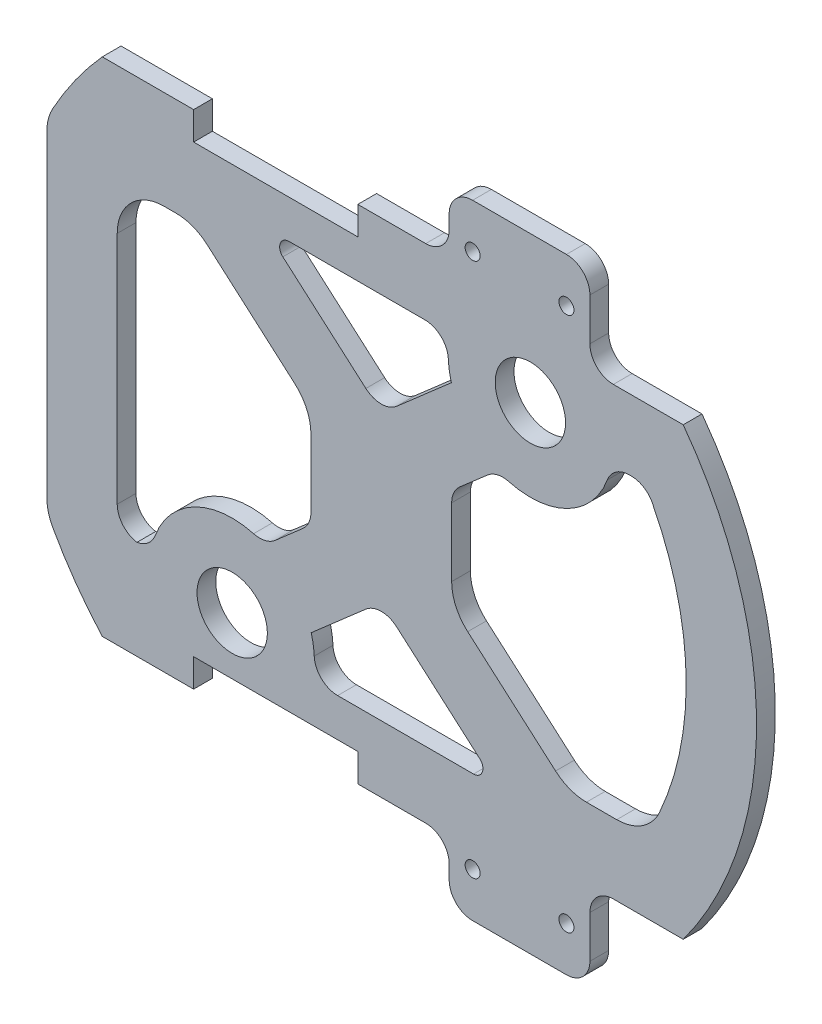
from build123d import *

# Parameters (mm, degrees)
ESBO_O1_R                = 7.5
ESBO_O1_R_2              = 1.6
RESSALTO_EXTRUS_O1_DEPTH = 4
FILETE2_R                = 10
FILETE3_R                = 5
FILETE4_R                = 2


with BuildPart() as part:
    # Esboço1 → Ressalto-extrusão1 (new body)
    with BuildSketch(Plane.XY):
        with BuildLine():
            Line((14.471901241, -53.5), (14.471901241, -66.5))
            Line((14.471901241, -66.5), (44.471901241, -66.5))
            Line((44.471901241, -66.5), (44.471901241, -47.5))
            Line((44.471901241, -47.5), (64.371965948, -47.5))
            ThreePointArc((64.371965948, -47.5), (80, 0), (64.371965948, 47.5))
            Line((64.371965948, 47.5), (44.471901241, 47.5))
            Line((44.471901241, 47.5), (44.471901241, 66.5))
            Line((44.471901241, 66.5), (14.471901241, 66.5))
            Line((14.471901241, 66.5), (14.471901241, 53.5))
            Line((14.471901241, 53.5), (-5.003543323, 53.5))
            Line((-5.003543323, 53.5), (-5.003543323, 47.5))
            Line((-5.003543323, 47.5), (-40.003543323, 47.5))
            Line((-40.003543323, 47.5), (-40.003543323, 53.5))
            Line((-40.003543323, 53.5), (-59.478987886, 53.5))
            ThreePointArc((-59.478987886, 53.5), (-65.948635083, 45.285511266), (-71.291651246, 36.297389198))
            Line((-71.291651246, 36.297389198), (-71.291651246, -36.297389198))
            ThreePointArc((-71.291651246, -36.297389198), (-65.948635083, -45.285511266), (-59.478987886, -53.5))
            Line((-59.478987886, -53.5), (-40.003543323, -53.5))
            Line((-40.003543323, -53.5), (-40.003543323, -47.5))
            Line((-40.003543323, -47.5), (-5.003543323, -47.5))
            Line((-5.003543323, -47.5), (-5.003543323, -53.5))
            Line((-5.003543323, -53.5), (14.471901241, -53.5))
        make_face()
        with Locations((-31.783703802, -35.29937921)):
            Circle(ESBO_O1_R, mode=Mode.SUBTRACT)
        with Locations((19.471901241, -57)):
            Circle(ESBO_O1_R_2, mode=Mode.SUBTRACT)
        with Locations((39.471901241, -57)):
            Circle(ESBO_O1_R_2, mode=Mode.SUBTRACT)
        with BuildLine():
            Line((25, -39.332538239), (-14.754798134, -39.332538239))
            ThreePointArc((-14.754798134, -39.332538239), (-14.287636143, -34.928412284), (-14.941054623, -30.548045856))
            Line((-14.941054623, -30.548045856), (0, -17.5))
            Line((0, -17.5), (25, -39.332538239))
        make_face(mode=Mode.SUBTRACT)
        with BuildLine():
            Line((-15, -10.684767074), (-24.807750727, -19.249890785))
            ThreePointArc((-24.807750727, -19.249890785), (-40.174599446, -19.942202702), (-49.058352164, -32.5))
            Line((-49.058352164, -32.5), (-56.291651246, -32.5))
            Line((-56.291651246, -32.5), (-56.291651246, 32.5))
            Line((-56.291651246, 32.5), (-39.980184035, 32.5))
            Line((-39.980184035, 32.5), (-15, 10.684767074))
            Line((-15, 10.684767074), (-15, -10.684767074))
        make_face(mode=Mode.SUBTRACT)
        with BuildLine():
            Line((49.058352164, 32.5), (56.291651246, 32.5))
            ThreePointArc((56.291651246, 32.5), (65, 0), (56.291651246, -32.5))
            Line((56.291651246, -32.5), (39.980184035, -32.5))
            Line((39.980184035, -32.5), (15, -10.684767074))
            Line((15, -10.684767074), (15, 10.684767074))
            Line((15, 10.684767074), (24.807750727, 19.249890785))
            ThreePointArc((24.807750727, 19.249890785), (40.174599446, 19.942202702), (49.058352164, 32.5))
        make_face(mode=Mode.SUBTRACT)
        with BuildLine():
            Line((0, 17.5), (-25, 39.332538239))
            Line((-25, 39.332538239), (14.754798134, 39.332538239))
            ThreePointArc((14.754798134, 39.332538239), (14.287636143, 34.928412284), (14.941054623, 30.548045856))
            Line((14.941054623, 30.548045856), (0, 17.5))
        make_face(mode=Mode.SUBTRACT)
        with Locations((19.471901241, 57)):
            Circle(ESBO_O1_R_2, mode=Mode.SUBTRACT)
        with Locations((39.471901241, 57)):
            Circle(ESBO_O1_R_2, mode=Mode.SUBTRACT)
        with Locations((31.783703802, 35.29937921)):
            Circle(ESBO_O1_R, mode=Mode.SUBTRACT)
    extrude(amount=RESSALTO_EXTRUS_O1_DEPTH)

    # Filete2
    filete2_edges = [part.edges().sort_by_distance(p)[0] for p in [
        (-71.291651246, -36.297389198, 2),
        (-71.291651246, 36.297389198, 2),
        (15, -10.684767074, 2),
        (39.980184035, -32.5, 2),
        (56.291651246, -32.5, 2),
        (-15, 10.684767074, 2),
        (-39.980184035, 32.5, 2),
        (-56.291651246, 32.5, 2),
    ]]
    fillet(filete2_edges, radius=FILETE2_R)

    # Filete3
    # the kernel refuses this fillet: 5 mm, written as the material it adds along each edge
    with BuildSketch(Plane(origin=(56.291651246, 32.5, 0), x_dir=(0.47930172295418866, -0.8776501913479802, 0), z_dir=(0, 0, 1))) as filete3_piece_1:
        with BuildLine():
            CenterArc((2.96720344, -4.998591114), FILETE3_R, 88.639806368, 62.720387264)
            Line((-1.421047517, -2.602082499), (0, 0))
            ThreePointArc((0, 0), (1.542945789, 0.018315517), (3.085891577, 0))
        make_face()
    extrude(amount=4)
    with BuildSketch(Plane(origin=(49.058352164, 32.5, 0), x_dir=(1, 0, 0), z_dir=(0, 0, 1))) as filete3_piece_2:
        with BuildLine():
            CenterArc((3.830319867, -5), FILETE3_R, 90, 69.718116788)
            ThreePointArc((-0.859673073, -3.26680462), (-0.35082821, -1.654193676), (0, 0))
            Line((0, 0), (3.830319867, 0))
        make_face()
    extrude(amount=4)
    with BuildSketch(Plane(origin=(24.807750727, 19.249890785, 0), x_dir=(0.9437647380510182, -0.3306177841730431, 0), z_dir=(0, 0, 1))) as filete3_piece_3:
        with BuildLine():
            CenterArc((2.919799374, -4.986661539), FILETE3_R, 94.186027535, 56.251011404)
            Line((-1.429270912, -2.519763153), (0, 0))
            ThreePointArc((0, 0), (1.277412226, -0.046684613), (2.554824452, 0))
        make_face()
    extrude(amount=4)
    with BuildSketch(Plane(origin=(15, 10.684767074, 0), x_dir=(0.7532103380208672, 0.6577797402615034, 0), z_dir=(0, 0, 1))) as filete3_piece_4:
        with BuildLine():
            CenterArc((FILETE3_R * 0.454348861751, -FILETE3_R), FILETE3_R, 90, 48.869237816)
            Line((-FILETE3_R * 0.29886147627, -FILETE3_R * 0.342220259738), (0, 0))
            Line((0, 0), (FILETE3_R * 0.454348861751, 0))
        make_face()
    extrude(amount=4)
    with BuildSketch(Plane(origin=(-15, -10.684767074, 0), x_dir=(0, 1, 0), z_dir=(0, 0, 1))) as filete3_piece_5:
        with BuildLine():
            CenterArc((FILETE3_R * 0.454348861751, FILETE3_R), FILETE3_R, 221.130762184, 48.869237816)
            Line((-FILETE3_R * 0.29886147627, FILETE3_R * 0.342220259738), (0, 0))
            Line((0, 0), (FILETE3_R * 0.454348861751, 0))
        make_face()
    extrude(amount=4)
    with BuildSketch(Plane(origin=(-24.807750727, -19.249890785, 0), x_dir=(0.7532103380209099, 0.6577797402614547, 0), z_dir=(0, 0, 1))) as filete3_piece_6:
        with BuildLine():
            CenterArc((2.896898633, 5), FILETE3_R, 213.748988596, 56.251011404)
            ThreePointArc((-1.260498463, 2.222222222), (-0.589642299, 1.13414435), (0, 0))
            Line((0, 0), (2.896898633, 0))
        make_face()
    extrude(amount=4)
    with BuildSketch(Plane(origin=(-49.058352164, -32.5, 0), x_dir=(0.2544898792174261, 0.9670754372725532, 0), z_dir=(0, 0, 1))) as filete3_piece_7:
        with BuildLine():
            CenterArc((3.860599546, 4.976657656), FILETE3_R, 194.74336021, 69.718116788)
            Line((-0.97477764, 3.70420826), (0, 0))
            ThreePointArc((0, 0), (1.689012301, 0.081698204), (3.378024603, 0))
        make_face()
    extrude(amount=4)
    with BuildSketch(Plane(origin=(14.754798134, 39.332538239, 0), x_dir=(-0.09464454898712658, -0.9955111296952049, 0), z_dir=(0, 0, 1))) as filete3_piece_8:
        with BuildLine():
            CenterArc((5.493397952, -4.952623325), FILETE3_R, 97.893660423, 87.537201367)
            Line((0.515842303, -5.42584607), (0, 0))
            ThreePointArc((0, 0), (2.403361604, -0.165818364), (4.806723208, 0))
        make_face()
    extrude(amount=4)
    with BuildSketch(Plane(origin=(0, 17.5, 0), x_dir=(0.7532103380208671, 0.6577797402615035, 0), z_dir=(0, 0, 1)), Plane(origin=(0, -17.5, 0), x_dir=(-0.7532103380208676, -0.6577797402615031, 0), z_dir=(0, 0, 1))) as filete3_piece_9:
        with BuildLine():
            CenterArc((FILETE3_R * 0.873301529543, FILETE3_R), FILETE3_R, 187.738475632, 82.261524368)
            Line((-FILETE3_R * 0.117591471468, FILETE3_R * 0.865348373397), (0, 0))
            Line((0, 0), (FILETE3_R * 0.873301529543, 0))
        make_face()
    extrude(amount=4)
    with BuildSketch(Plane(origin=(-14.754798134, -39.332538239, 0), x_dir=(1, 0, 0), z_dir=(0, 0, 1))) as filete3_piece_10:
        with BuildLine():
            CenterArc((5.450311812, 5), FILETE3_R, 182.462798633, 87.537201367)
            ThreePointArc((0.45493015, 4.785146451), (0.392539102, 2.376879421), (0, 0))
            Line((0, 0), (5.450311812, 0))
        make_face()
    extrude(amount=4)
    with BuildSketch(Plane(origin=(14.471901241, 53.5, 0), x_dir=(-1, 0, 0), z_dir=(0, 0, 1)), Plane(origin=(44.471901241, -47.5, 0), x_dir=(1, 0, 0), z_dir=(0, 0, 1)), Plane(origin=(44.471901241, 47.5, 0), x_dir=(0, 1, 0), z_dir=(0, 0, 1))) as filete3_piece_11:
        with BuildLine():
            CenterArc((FILETE3_R, -FILETE3_R), FILETE3_R, 90, 90)
            Line((0, -FILETE3_R), (0, 0))
            Line((0, 0), (FILETE3_R, 0))
        make_face()
    extrude(amount=4)
    with BuildSketch(Plane(origin=(14.471901241, -53.5, 0), x_dir=(-1, 0, 0), z_dir=(0, 0, 1)), Plane(origin=(-56.291651246, -32.5, 0), x_dir=(1, 0, 0), z_dir=(0, 0, 1))) as filete3_piece_12:
        with BuildLine():
            CenterArc((FILETE3_R, FILETE3_R), FILETE3_R, 180, 90)
            Line((0, FILETE3_R), (0, 0))
            Line((0, 0), (FILETE3_R, 0))
        make_face()
    extrude(amount=4)
    # the kernel refuses this fillet: 5 mm, written as the material it takes off along each edge
    with BuildSketch(Plane(origin=(14.471901241, -66.5, -12.5), x_dir=(0, 1, 0), z_dir=(0, 0, 1)), Plane(origin=(44.471901241, -66.5, -12.5), x_dir=(-1, 0, 0), z_dir=(0, 0, 1))) as filete3_2_piece_1:
        with BuildLine():
            CenterArc((FILETE3_R, -FILETE3_R), FILETE3_R, 90, 90)
            Line((0, -FILETE3_R), (0, 0))
            Line((0, 0), (FILETE3_R, 0))
        make_face()
    extrude(amount=29, mode=Mode.SUBTRACT)
    with BuildSketch(Plane(origin=(14.471901241, 66.5, -12.5), x_dir=(0, -1, 0), z_dir=(0, 0, 1)), Plane(origin=(44.471901241, 66.5, -12.5), x_dir=(-1, 0, 0), z_dir=(0, 0, 1))) as filete3_2_piece_2:
        with BuildLine():
            CenterArc((FILETE3_R, FILETE3_R), FILETE3_R, 180, 90)
            Line((0, FILETE3_R), (0, 0))
            Line((0, 0), (FILETE3_R, 0))
        make_face()
    extrude(amount=29, mode=Mode.SUBTRACT)

    # Filete4
    filete4_edges = [part.edges().sort_by_distance(p)[0] for p in [
        (-25, 39.332538239, 2),
        (25, -39.332538239, 2),
    ]]
    fillet(filete4_edges, radius=FILETE4_R)


solid = part.part
